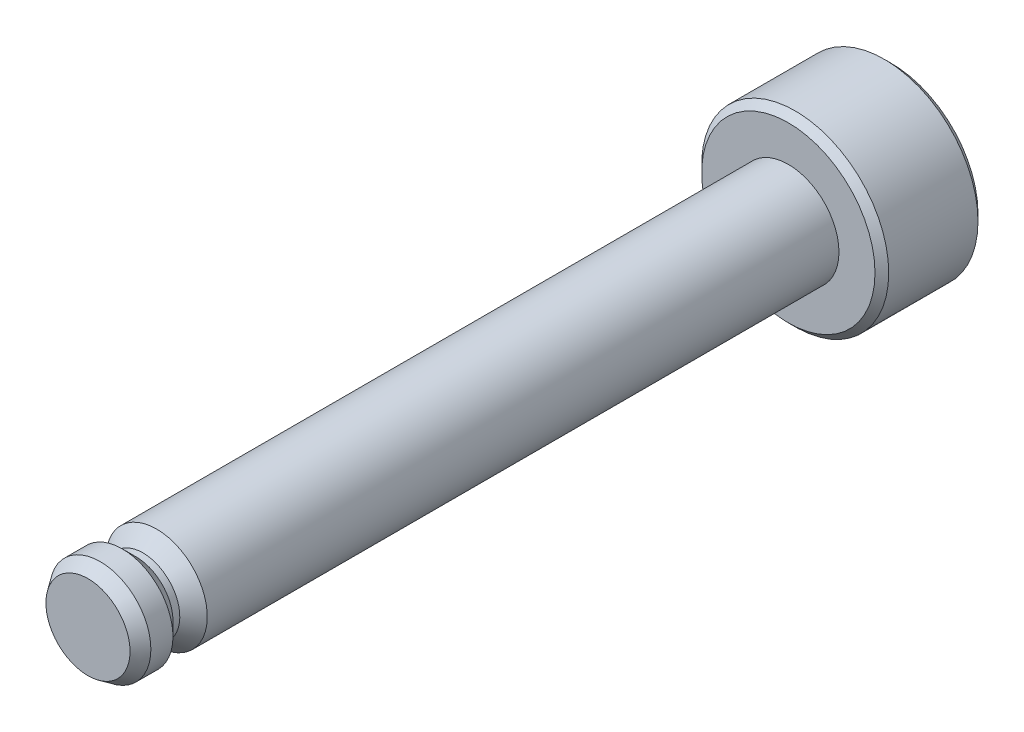
from build123d import *

# Parameters (mm, degrees)
SKETCH2_R      = 1.475
SHAFT_DEPTH    = 20.4
SKETCH5_R      = 2.725
HEAD_DEPTH     = 3
CHAMFER1_SIZE  = 0.25
CHAMFER1_SIZE2 = 0.357037002
DEBURS_SIZE    = 0.2


with BuildPart() as part:
    # Sketch2 → Shaft (new body)
    with BuildSketch(Plane.XY):
        Circle(SKETCH2_R)
    extrude(amount=SHAFT_DEPTH)

    # Sketch5 → Head (add)
    with BuildSketch(Plane.XY):
        Circle(SKETCH5_R)
    extrude(amount=-HEAD_DEPTH)

    # Chamfer1
    chamfer1_edges = [part.edges().sort_by_distance(p)[0] for p in [
        (-1.475, 0, 20.4),
    ]]
    chamfer1_side = [part.faces().sort_by_distance(p)[0] for p in [
        (0, 0, 20.4),
    ]]
    chamfer(chamfer1_edges, length=CHAMFER1_SIZE, length2=CHAMFER1_SIZE2, reference=chamfer1_side[0])

    # Deburs
    deburs_edges = [part.edges().sort_by_distance(p)[0] for p in [
        (-2.725, 0, 0),
        (-2.725, 0, -3),
    ]]
    chamfer(deburs_edges, length=DEBURS_SIZE)

    # Sketch6 → e-Clip Notch Long (revolve, cut)
    with BuildSketch(Plane(origin=(0, 0, 0), x_dir=(0, 0, -1), z_dir=(1, 0, 0))):
        Polygon((-19.4, 1.475), (-18.4, 1.475), (-18.8, 1.075), (-19, 1.075), align=None)
    revolve(axis=Axis((0, 0, 0), (0, 0, 1)), mode=Mode.SUBTRACT)


solid = part.part
